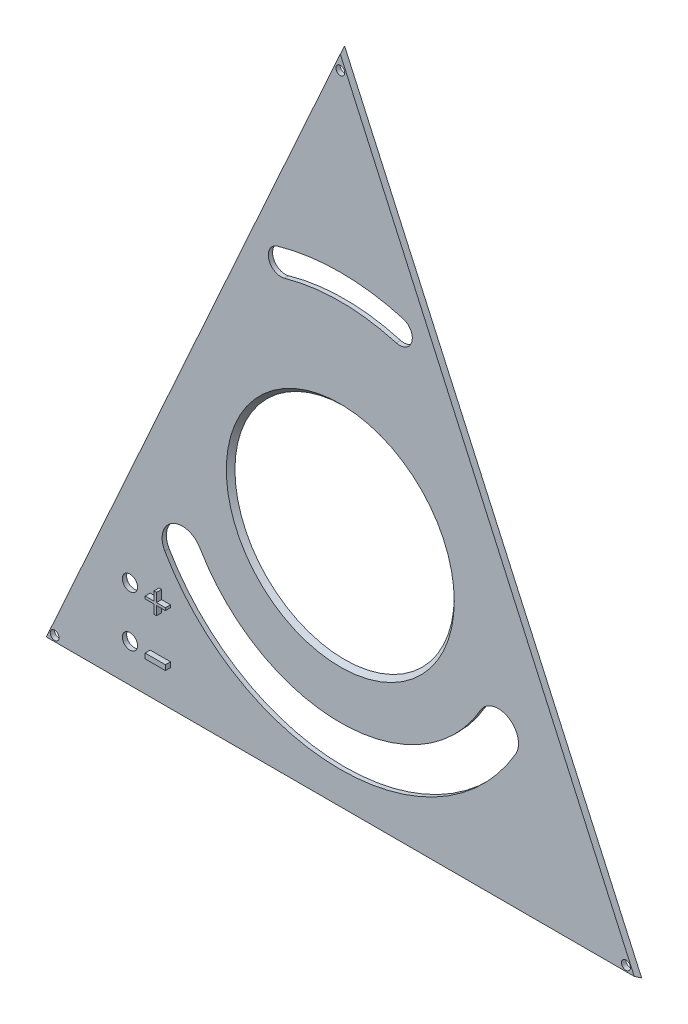
from build123d import *

# Parameters (mm, degrees)
BOSS_EXTRUDE1_DEPTH = 1.7
BOSS_EXTRUDE1_TAPER = 25
SKETCH2_R           = 40
CUT_EXTRUDE1_DEPTH  = 204.652444278
SKETCH3_R           = 1.75
CUT_EXTRUDE2_DEPTH  = 204.652444278
CHAMFER1_SIZE       = 5
CUT_EXTRUDE4_REACH  = 205.652
SKETCH4_R           = 3
SKETCH6_W           = 8
SKETCH6_H           = 2
BOSS_EXTRUDE2_DEPTH = 2


with BuildPart() as part:
    # Sketch1 → Boss-Extrude1 (new body)
    with BuildSketch(Plane.XY):
        Polygon((117.27472237, -93.523470279), (0, 166.487439626), (-117.27472237, -93.523470279), align=None)
    extrude(amount=BOSS_EXTRUDE1_DEPTH, taper=BOSS_EXTRUDE1_TAPER)

    # Sketch2 → Cut-Extrude1 (cut, through all)
    with BuildSketch(Plane.XY.offset(1.7)):
        Circle(SKETCH2_R)
    extrude(amount=-CUT_EXTRUDE1_DEPTH, mode=Mode.SUBTRACT)

    # Sketch3 → Cut-Extrude2 (cut, through all)
    with BuildSketch(Plane.XY.offset(1.7)):
        with Locations((0, 158.987439626)):
            Circle(SKETCH3_R)
        with Locations((112.77472237, -90.523470279)):
            Circle(SKETCH3_R)
        with Locations((-112.77472237, -90.523470279)):
            Circle(SKETCH3_R)
    extrude(amount=-CUT_EXTRUDE2_DEPTH, mode=Mode.SUBTRACT)

    # Chamfer1
    # the kernel refuses this chamfer: 5 mm, written as the material it takes off along each edge
    with BuildSketch(Plane(origin=(0, 0, 1.7), x_dir=(1, 0, 0), z_dir=(0, -1, 0))) as chamfer1_piece_1:
        Polygon((40, -CHAMFER1_SIZE), (40 + CHAMFER1_SIZE, 0), (40, 0), align=None)
    revolve(axis=Axis((0, 0, 1.7), (0, 0, 1)), mode=Mode.SUBTRACT)

    # Sketch4 → Cut-Extrude4 (cut, up to next)
    with BuildSketch(Plane.XY.offset(1.7), mode=Mode.PRIVATE) as cut_extrude4_sk1:
        with Locations((-83.047547857, -57.73074726)):
            Circle(SKETCH4_R)
    cut_extrude4_tool1 = extrude(cut_extrude4_sk1.sketch, amount=-CUT_EXTRUDE4_REACH, mode=Mode.PRIVATE) & part.part
    # Sketch4 → Cut-Extrude4 (cut, up to next)
    with BuildSketch(Plane.XY.offset(1.7), mode=Mode.PRIVATE) as cut_extrude4_sk2:
        with Locations((-83.047547857, -77.73074726)):
            Circle(SKETCH4_R)
    cut_extrude4_tool2 = extrude(cut_extrude4_sk2.sketch, amount=-CUT_EXTRUDE4_REACH, mode=Mode.PRIVATE) & part.part
    # Sketch4 → Cut-Extrude4 (cut, up to next)
    with BuildSketch(Plane.XY.offset(1.7), mode=Mode.PRIVATE) as cut_extrude4_sk3:
        with BuildLine():
            ThreePointArc((69.282032303, -40), (0, -80), (-69.282032303, -40))
            ThreePointArc((-69.282032303, -40), (-66.353829072, -29.07179677), (-55.425625842, -32))
            ThreePointArc((-55.425625842, -32), (0, -64), (55.425625842, -32))
            ThreePointArc((55.425625842, -32), (66.353829072, -29.07179677), (69.282032303, -40))
        make_face()
    cut_extrude4_tool3 = extrude(cut_extrude4_sk3.sketch, amount=-CUT_EXTRUDE4_REACH, mode=Mode.PRIVATE) & part.part
    # Sketch4 → Cut-Extrude4 (cut, up to next)
    with BuildSketch(Plane.XY.offset(1.7), mode=Mode.PRIVATE) as cut_extrude4_sk4:
        with BuildLine():
            ThreePointArc((-24.807362024, 86.513552634), (0, 90), (24.807362024, 86.513552634))
            ThreePointArc((24.807362024, 86.513552634), (28.235483724, 80.329057376), (22.050988465, 76.900935675))
            ThreePointArc((22.050988465, 76.900935675), (0, 80), (-22.050988465, 76.900935675))
            ThreePointArc((-22.050988465, 76.900935675), (-28.235483724, 80.329057376), (-24.807362024, 86.513552634))
        make_face()
    cut_extrude4_tool4 = extrude(cut_extrude4_sk4.sketch, amount=-CUT_EXTRUDE4_REACH, mode=Mode.PRIVATE) & part.part
    add(cut_extrude4_tool1.solids().sort_by_distance((-83.047548, -57.730747, 1.7))[0], mode=Mode.SUBTRACT)
    add(cut_extrude4_tool2.solids().sort_by_distance((-83.047548, -77.730747, 1.7))[0], mode=Mode.SUBTRACT)
    add(cut_extrude4_tool3.solids().sort_by_distance((0, -78.499912, 1.7))[0], mode=Mode.SUBTRACT)
    add(cut_extrude4_tool4.solids().sort_by_distance((0, 83.588343, 1.7))[0], mode=Mode.SUBTRACT)

    # Sketch6 → Boss-Extrude2 (add)
    with BuildSketch(Plane.XY.offset(1.7)):
        Polygon((-71.547547857, -53.73074726), (-70.547547857, -53.73074726), (-70.547547857, -57.23074726), (-67.047547857, -57.23074726), (-67.047547857, -58.23074726), (-70.547547857, -58.23074726), (-70.547547857, -61.73074726), (-71.547547857, -61.73074726), (-71.547547857, -58.23074726), (-75.047547857, -58.23074726), (-75.047547857, -57.23074726), (-71.547547857, -57.23074726), align=None)
        with Locations((-71.047547857, -77.73074726)):
            Rectangle(SKETCH6_W, SKETCH6_H)
    extrude(amount=BOSS_EXTRUDE2_DEPTH)


solid = part.part
